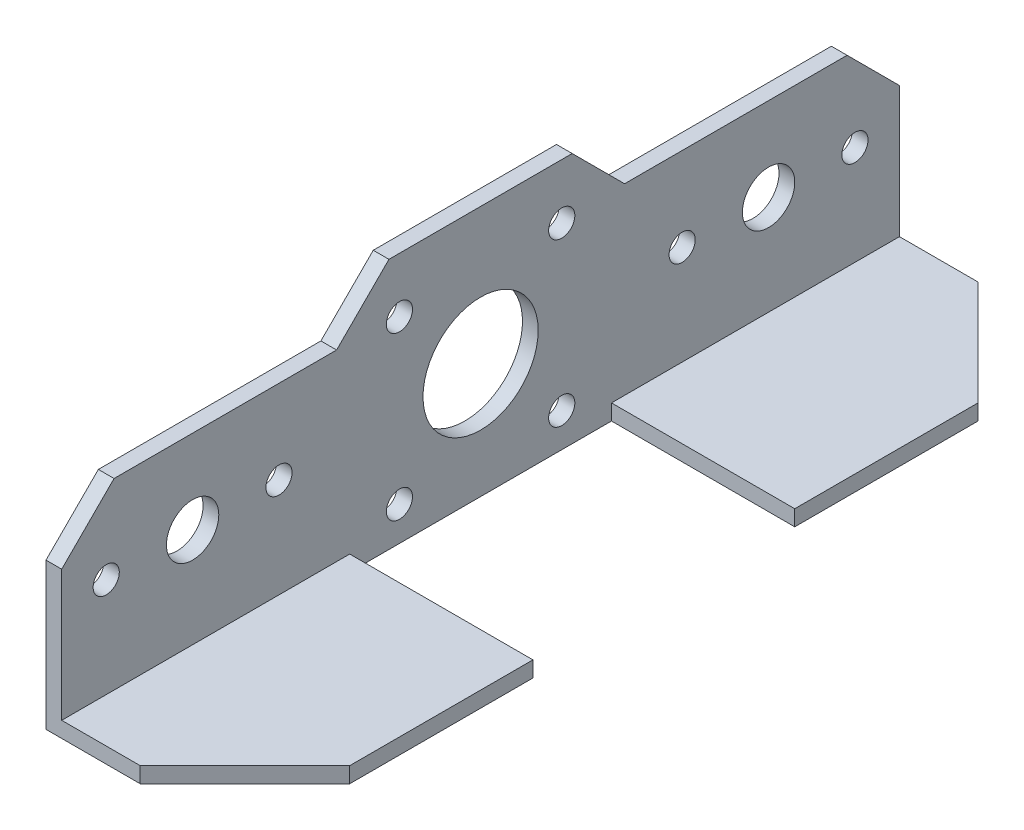
from build123d import *

# Parameters (mm, degrees)
SALIENTE_EXTRUIR1_DEPTH      = 80
SALIENTE_EXTRUIR1_DEPTH_BACK = 80
CROQUIS2_W                   = 35
CROQUIS2_H                   = 50
CORTAR_EXTRUIR1_DEPTH        = 3
CHAFL_N1_SIZE                = 20
CROQUIS3_R                   = 5
CROQUIS3_R_2                 = 2.5
CORTAR_EXTRUIR2_DEPTH        = 3
CROQUIS4_W                   = 55
CROQUIS4_H                   = 10
SALIENTE_EXTRUIR2_DEPTH      = 3
CROQUIS5_R                   = 2.5
CROQUIS5_R_2                 = 11
CORTAR_EXTRUIR3_DEPTH        = 3
CHAFL_N2_SIZE                = 10


with BuildPart() as part:
    # Croquis1 → Saliente-Extruir1 (new, two sides: drawn at the far end of the back side and taken through both)
    with BuildSketch(Plane.XY.offset(-SALIENTE_EXTRUIR1_DEPTH_BACK)):
        Polygon((0, 0), (0, 38), (3, 38), (3, 3), (38, 3), (38, 0), align=None)
    extrude(amount=SALIENTE_EXTRUIR1_DEPTH + SALIENTE_EXTRUIR1_DEPTH_BACK)

    # Croquis2 → Cortar-Extruir1 (cut)
    with BuildSketch(Plane(origin=(0, 3, 0), x_dir=(1, 0, 0), z_dir=(0, 1, 0))):
        with Locations((20.5, 0)):
            Rectangle(CROQUIS2_W, CROQUIS2_H)
    extrude(amount=-CORTAR_EXTRUIR1_DEPTH, mode=Mode.SUBTRACT)

    # Chaflán1
    chafl_n1_edges = [part.edges().sort_by_distance(p)[0] for p in [
        (38, 1.5, 80),
        (38, 1.5, -80),
    ]]
    chamfer(chafl_n1_edges, length=CHAFL_N1_SIZE)

    # Croquis3 → Cortar-Extruir2 (cut)
    with BuildSketch(Plane(origin=(3, 0, 0), x_dir=(0, 0, -1), z_dir=(1, 0, 0))):
        with Locations((-55, 22)):
            Circle(CROQUIS3_R)
        with Locations((-71.5, 22)):
            Circle(CROQUIS3_R_2)
        with Locations((-38.5, 22)):
            Circle(CROQUIS3_R_2)
        with Locations(Location((38.5, 22, 0), (0, 0, 180))):
            Circle(CROQUIS3_R_2)
        with Locations(Location((55, 22, 0), (0, 0, 180))):
            Circle(CROQUIS3_R)
        with Locations(Location((71.5, 22, 0), (0, 0, 180))):
            Circle(CROQUIS3_R_2)
    extrude(amount=-CORTAR_EXTRUIR2_DEPTH, mode=Mode.SUBTRACT)

    # Croquis4 → Saliente-Extruir2 (add)
    with BuildSketch(Plane.ZY):
        with Locations((0, 43)):
            Rectangle(CROQUIS4_W, CROQUIS4_H)
    extrude(amount=-SALIENTE_EXTRUIR2_DEPTH)

    # Croquis5 → Cortar-Extruir3 (cut)
    with BuildSketch(Plane.ZY):
        with Locations((-15.5, 37.5)):
            Circle(CROQUIS5_R)
        with Locations((15.5, 37.5)):
            Circle(CROQUIS5_R)
        with Locations((15.5, 6.5)):
            Circle(CROQUIS5_R)
        with Locations((-15.5, 6.5)):
            Circle(CROQUIS5_R)
        with Locations((0, 22)):
            Circle(CROQUIS5_R_2)
    extrude(amount=-CORTAR_EXTRUIR3_DEPTH, mode=Mode.SUBTRACT)

    # Chaflán2
    chafl_n2_edges = [part.edges().sort_by_distance(p)[0] for p in [
        (1.5, 38, 80),
        (1.5, 38, -80),
        (1.5, 48, -27.5),
        (1.5, 48, 27.5),
    ]]
    chamfer(chafl_n2_edges, length=CHAFL_N2_SIZE - 0.0001)  # a hair under: the kernel refuses the full size


solid = part.part
